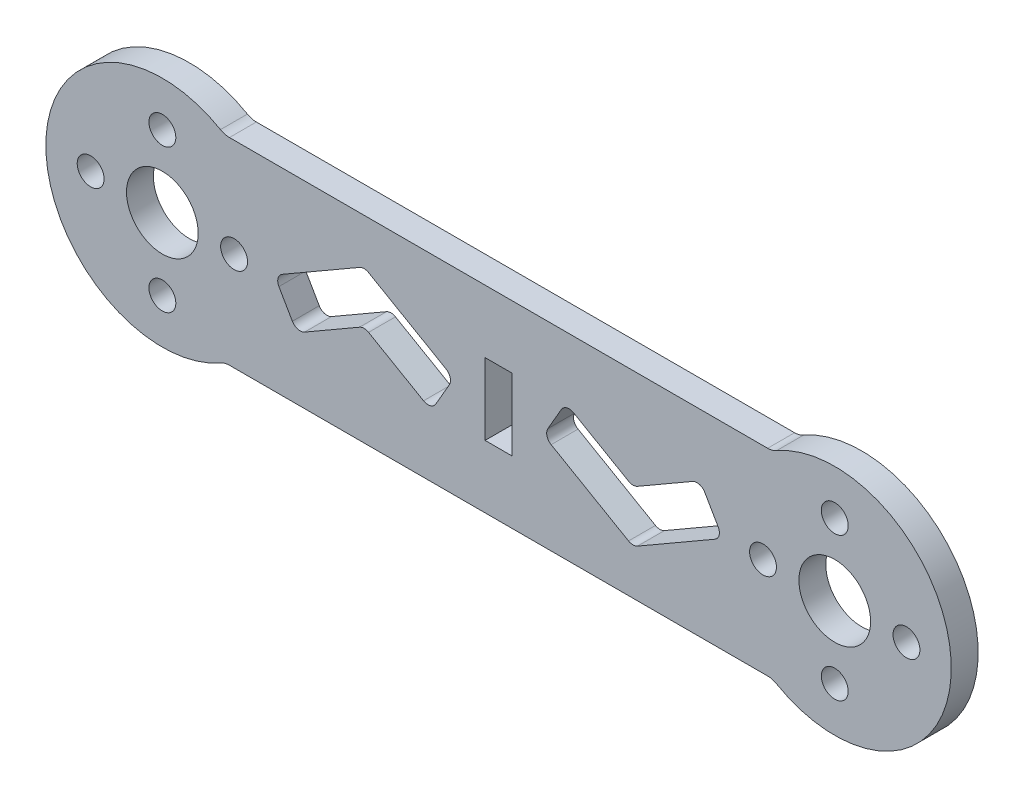
from build123d import *

# Parameters (mm, degrees)
SZKIC1_R                    = 4
DODANIE_WYCI_GNI_CIE1_DEPTH = 3
SZKIC2_R                    = 1.5
WYTNIJ_WYCI_GNI_CIE1_DEPTH  = 53.232652623
ZAOKR_GLENIE1_R             = 2
WYTNIJ_WYCI_GNI_CIE6_DEPTH  = 10
ZAOKR_GLENIE2_R             = 1
SZKIC7_W                    = 3
SZKIC7_H                    = 8
WYTNIJ_WYCI_GNI_CIE7_DEPTH  = 10


with BuildPart() as part:
    # Szkic1 → Dodanie-wyciągnięcie1 (new body)
    with BuildSketch(Plane.XY):
        with BuildLine():
            Line((-30.57179677, -11), (30.57179677, -11))
            ThreePointArc((30.57179677, -11), (50.5, 0), (30.57179677, 11))
            Line((30.57179677, 11), (-30.57179677, 11))
            ThreePointArc((-30.57179677, 11), (-50.5, 0), (-30.57179677, -11))
        make_face()
        with Locations((37.5, 0)):
            Circle(SZKIC1_R, mode=Mode.SUBTRACT)
        with Locations((-37.5, 0)):
            Circle(SZKIC1_R, mode=Mode.SUBTRACT)
    extrude(amount=DODANIE_WYCI_GNI_CIE1_DEPTH)

    # Szkic2 → Wytnij-wyciągnięcie1 (cut, through all)
    with BuildSketch(Plane.XY.offset(3)):
        with Locations((45.5, 0)):
            Circle(SZKIC2_R)
        with Locations((37.5, -8)):
            Circle(SZKIC2_R)
        with Locations((29.5, 0)):
            Circle(SZKIC2_R)
        with Locations((37.5, 8)):
            Circle(SZKIC2_R)
    wytnij_wyci_gni_cie1 = extrude(amount=-WYTNIJ_WYCI_GNI_CIE1_DEPTH, mode=Mode.SUBTRACT)

    # Lustro1: Wytnij-wyciągnięcie1 across plane
    add(wytnij_wyci_gni_cie1.mirror(Plane(origin=(0, 0, 0), x_dir=(0, 0, 1), z_dir=(1, 0, 0))), mode=Mode.SUBTRACT)

    # Zaokrąglenie1
    zaokr_glenie1_edges = [part.edges().sort_by_distance(p)[0] for p in [
        (-30.57179677, -11, 1.5),
        (-30.57179677, 11, 1.5),
        (30.57179677, 11, 1.5),
        (30.57179677, -11, 1.5),
    ]]
    fillet(zaokr_glenie1_edges, radius=ZAOKR_GLENIE1_R)

    # Szkic6 → Wytnij-wyciągnięcie6 (cut)
    with BuildSketch(Plane.XY.offset(3)):
        Polygon((-15, 6), (-25, 0.226497308), (-22.5, -4.103629711), (-15, 0.226497308), (-7.5, -4.103629711), (-5, 0.226497308), align=None)
        Polygon((25, -0.226497308), (22.5, 4.103629711), (15, -0.226497308), (7.5, 4.103629711), (5, -0.226497308), (15, -6), align=None)
    extrude(amount=-WYTNIJ_WYCI_GNI_CIE6_DEPTH, mode=Mode.SUBTRACT)

    # Zaokrąglenie2
    zaokr_glenie2_edges = [part.edges().sort_by_distance(p)[0] for p in [
        (7.5, 4.103629711, 1.5),
        (5, -0.226497308, 1.5),
        (15, -6, 1.5),
        (25, -0.226497308, 1.5),
        (22.5, 4.103629711, 1.5),
        (15, -0.226497308, 1.5),
        (-15, 6, 1.5),
        (-5, 0.226497308, 1.5),
        (-7.5, -4.103629711, 1.5),
        (-15, 0.226497308, 1.5),
        (-22.5, -4.103629711, 1.5),
        (-25, 0.226497308, 1.5),
    ]]
    fillet(zaokr_glenie2_edges, radius=ZAOKR_GLENIE2_R)

    # Szkic7 → Wytnij-wyciągnięcie7 (cut)
    with BuildSketch(Plane.XY.offset(3)):
        Rectangle(SZKIC7_W, SZKIC7_H)
    extrude(amount=-WYTNIJ_WYCI_GNI_CIE7_DEPTH, mode=Mode.SUBTRACT)


solid = part.part
